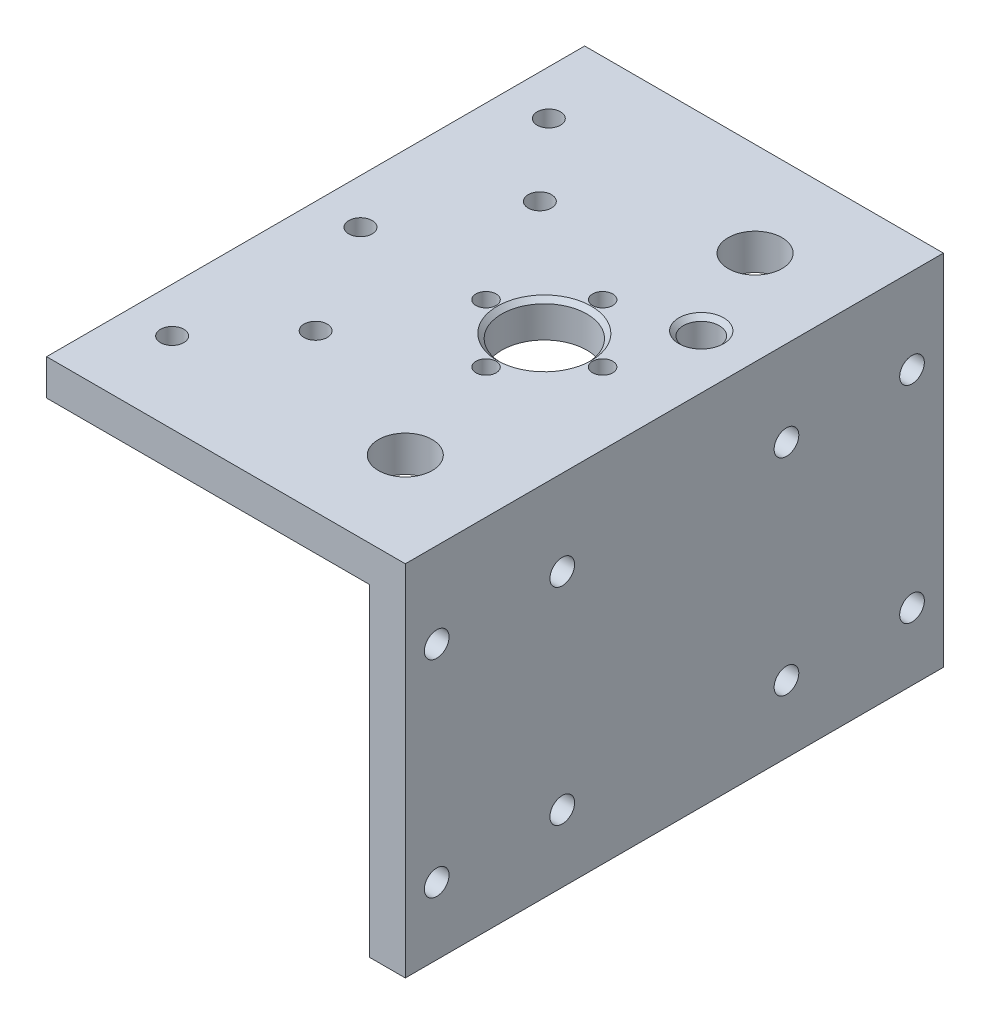
from build123d import *

# Parameters (mm, degrees)
ESTRUSIONE_ESTRUSIONE1_DEPTH = 120
TAGLIO_ESTRUSIONE2_REACH     = 166.924
SCHIZZO6_R                   = 6
TAGLIO_ESTRUSIONE3_REACH     = 166.924
SCHIZZO7_R                   = 9.5
SCHIZZO7_R_2                 = 4
FORO_PER_VITE_M4_2_D         = 4.5
SCHIZZO12_R                  = 2.75
TAGLIO_ESTRUSIONE4_DEPTH     = 10
SCHIZZO14_R                  = 2.6
TAGLIO_ESTRUSIONE5_DEPTH     = 10
SMUSSO1_SIZE                 = 1
SMUSSO2_SIZE                 = 1


with BuildPart() as part:
    # Schizzo1 → Estrusione-Estrusione1 (new body)
    with BuildSketch(Plane.XY):
        Polygon((0, 0), (-80, 0), (-80, -8), (-8, -8), (-8, -80), (0, -80), align=None)
    extrude(amount=ESTRUSIONE_ESTRUSIONE1_DEPTH)

    # Schizzo6 → Taglio-Estrusione2 (cut, up to next)
    with BuildSketch(Plane(origin=(0, 0, 0), x_dir=(1, 0, 0), z_dir=(0, 1, 0)), mode=Mode.PRIVATE) as taglio_estrusione2_sk1:
        with Locations((-21, -21)):
            Circle(SCHIZZO6_R)
    taglio_estrusione2_tool1 = extrude(taglio_estrusione2_sk1.sketch, amount=-TAGLIO_ESTRUSIONE2_REACH, mode=Mode.PRIVATE) & part.part
    # Schizzo6 → Taglio-Estrusione2 (cut, up to next)
    with BuildSketch(Plane(origin=(0, 0, 0), x_dir=(1, 0, 0), z_dir=(0, 1, 0)), mode=Mode.PRIVATE) as taglio_estrusione2_sk2:
        with Locations((-21, -99)):
            Circle(SCHIZZO6_R)
    taglio_estrusione2_tool2 = extrude(taglio_estrusione2_sk2.sketch, amount=-TAGLIO_ESTRUSIONE2_REACH, mode=Mode.PRIVATE) & part.part
    add(taglio_estrusione2_tool1.solids().sort_by_distance((-21, 0, 21))[0], mode=Mode.SUBTRACT)
    add(taglio_estrusione2_tool2.solids().sort_by_distance((-21, 0, 99))[0], mode=Mode.SUBTRACT)

    # Schizzo7 → Taglio-Estrusione3 (cut, up to next)
    with BuildSketch(Plane(origin=(0, 0, 0), x_dir=(1, 0, 0), z_dir=(0, 1, 0)), mode=Mode.PRIVATE) as taglio_estrusione3_sk1:
        with Locations((-29, -60)):
            Circle(SCHIZZO7_R)
    taglio_estrusione3_tool1 = extrude(taglio_estrusione3_sk1.sketch, amount=-TAGLIO_ESTRUSIONE3_REACH, mode=Mode.PRIVATE) & part.part
    # Schizzo7 → Taglio-Estrusione3 (cut, up to next)
    with BuildSketch(Plane(origin=(0, 0, 0), x_dir=(1, 0, 0), z_dir=(0, 1, 0)), mode=Mode.PRIVATE) as taglio_estrusione3_sk2:
        with Locations((-12, -42)):
            Circle(SCHIZZO7_R_2)
    taglio_estrusione3_tool2 = extrude(taglio_estrusione3_sk2.sketch, amount=-TAGLIO_ESTRUSIONE3_REACH, mode=Mode.PRIVATE) & part.part
    add(taglio_estrusione3_tool1.solids().sort_by_distance((-29, 0, 60))[0], mode=Mode.SUBTRACT)
    add(taglio_estrusione3_tool2.solids().sort_by_distance((-12, 0, 42))[0], mode=Mode.SUBTRACT)

    # Foro per Vite M4-2 (through all)
    with Locations(Plane(origin=(0, 0, 0), x_dir=(1, 0, 0), z_dir=(0, 1, 0))):
        with Locations((-29, -47), (-42, -60), (-29, -73), (-16, -60), (-29, -60)):
            Hole(FORO_PER_VITE_M4_2_D / 2)

    # Schizzo12 → Taglio-Estrusione4 (cut)
    with BuildSketch(Plane(origin=(0, 0, 0), x_dir=(0, 0, -1), z_dir=(1, 0, 0))):
        with Locations((-113, -19)):
            Circle(SCHIZZO12_R)
        with Locations((-85, -19)):
            Circle(SCHIZZO12_R)
        with Locations((-35, -19)):
            Circle(SCHIZZO12_R)
        with Locations((-7, -19)):
            Circle(SCHIZZO12_R)
        with Locations((-85, -65)):
            Circle(SCHIZZO12_R)
        with Locations((-113, -65)):
            Circle(SCHIZZO12_R)
        with Locations((-7, -65)):
            Circle(SCHIZZO12_R)
        with Locations((-35, -65)):
            Circle(SCHIZZO12_R)
    extrude(amount=-TAGLIO_ESTRUSIONE4_DEPTH, mode=Mode.SUBTRACT)

    # Schizzo14 → Taglio-Estrusione5 (cut)
    with BuildSketch(Plane(origin=(0, 0, 0), x_dir=(1, 0, 0), z_dir=(0, 1, 0))):
        with Locations((-70, -18)):
            Circle(SCHIZZO14_R)
        with Locations((-70, -60)):
            Circle(SCHIZZO14_R)
        with Locations((-70, -102)):
            Circle(SCHIZZO14_R)
        with Locations((-55, -35)):
            Circle(SCHIZZO14_R)
        with Locations((-55, -85)):
            Circle(SCHIZZO14_R)
    extrude(amount=-TAGLIO_ESTRUSIONE5_DEPTH, mode=Mode.SUBTRACT)

    # Smusso1
    smusso1_edges = [part.edges().sort_by_distance(p)[0] for p in [
        (-16, 0, 42),
    ]]
    chamfer(smusso1_edges, length=SMUSSO1_SIZE)

    # Smusso2
    smusso2_edges = [part.edges().sort_by_distance(p)[0] for p in [
        (-38.5, 0, 60),
    ]]
    chamfer(smusso2_edges, length=SMUSSO2_SIZE)


solid = part.part
